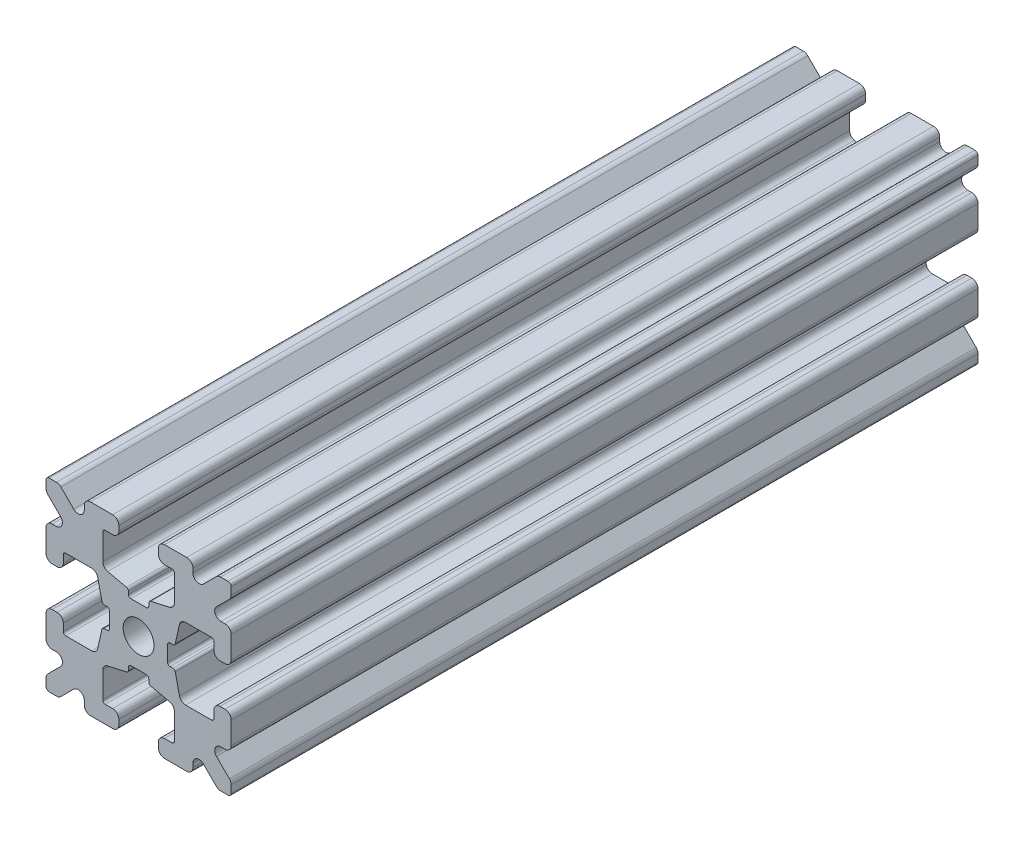
from build123d import *

# Parameters (mm, degrees)
SKETCH1_W           = 15
SKETCH1_H           = 15
SKETCH1_R           = 1.25
BOSS_EXTRUDE1_DEPTH = 30.25
FILLET1_R           = 0.25
CUT_EXTRUDE1_DEPTH  = 62.422715668
CUT_EXTRUDE3_DEPTH  = 62.422715668
FILLET3_R           = 0.5
FILLET4_R           = 0.5
FILLET5_R           = 3
FILLET6_R           = 0.2
CUT_EXTRUDE4_DEPTH  = 62.422715668
FILLET8_R           = 0.5
SKETCH6_W           = 5.1529354
SKETCH6_H           = 1.651
SKETCH6_W_2         = 1.651
SKETCH6_H_2         = 5.1529354
CUT_EXTRUDE5_DEPTH  = 62.422715668
FILLET10_R          = 0.2


with BuildPart() as part:
    # Sketch1 → Boss-Extrude1 (new, symmetric)
    with BuildSketch(Plane.XY):
        Rectangle(SKETCH1_W, SKETCH1_H)
        Circle(SKETCH1_R, mode=Mode.SUBTRACT)
    extrude(amount=BOSS_EXTRUDE1_DEPTH, both=True)

    # Fillet1
    fillet1_edges = [part.edges().sort_by_distance(p)[0] for p in [
        (7.5, -7.5, 0),
        (-7.5, -7.5, 0),
        (7.5, 7.5, 0),
        (-7.5, 7.5, 0),
    ]]
    fillet(fillet1_edges, radius=FILLET1_R)

    # Sketch2 → Cut-Extrude1 (cut, through all)
    with BuildSketch(Plane.XY.offset(30.25)):
        Polygon((-7.5, 1.6), (-6.1, 1.6), (-6.1, 2.9), (-3.4, 2.9), (-3.4, -2.9), (-6.1, -2.9), (-6.1, -1.6), (-7.5, -1.6), align=None)
        Polygon((2.9, 6.1), (1.6, 6.1), (1.6, 7.5), (-1.6, 7.5), (-1.6, 6.1), (-2.9, 6.1), (-2.9, 3.4), (2.9, 3.4), align=None)
        Polygon((-1.6, -7.5), (-1.6, -6.1), (-2.9, -6.1), (-2.9, -3.4), (2.9, -3.4), (2.9, -6.1), (1.6, -6.1), (1.6, -7.5), align=None)
        Polygon((6.1, -2.9), (6.1, -1.6), (7.5, -1.6), (7.5, 1.6), (6.1, 1.6), (6.1, 2.9), (3.4, 2.9), (3.4, -2.9), align=None)
    extrude(amount=-CUT_EXTRUDE1_DEPTH, mode=Mode.SUBTRACT)

    # Sketch4 → Cut-Extrude3 (cut, through all)
    with BuildSketch(Plane.XY.offset(30.25)):
        Polygon((-3.4, 2.9), (-2.75, 0), (-3.4, -2.9), align=None)
        Polygon((-2.9, 3.4), (0, 2.75), (2.9, 3.4), align=None)
        Polygon((3.4, 2.9), (2.75, 0), (3.4, -2.9), align=None)
        Polygon((-2.9, -3.4), (0, -2.75), (2.9, -3.4), align=None)
    extrude(amount=-CUT_EXTRUDE3_DEPTH, mode=Mode.SUBTRACT)

    # Fillet3
    fillet3_edges = [part.edges().sort_by_distance(p)[0] for p in [
        (-6.1, -1.6, 0),
        (-7.5, -1.6, 0),
        (-6.1, 1.6, 0),
        (-7.5, 1.6, 0),
        (-1.6, -7.5, 0),
        (-1.6, -6.1, 0),
        (1.6, -7.5, 0),
        (1.6, -6.1, 0),
        (6.1, -1.6, 0),
        (7.5, -1.6, 0),
        (7.5, 1.6, 0),
        (6.1, 1.6, 0),
        (1.6, 7.5, 0),
        (1.6, 6.1, 0),
        (-1.6, 7.5, 0),
        (-1.6, 6.1, 0),
    ]]
    fillet(fillet3_edges, radius=FILLET3_R)

    # Fillet4
    fillet4_edges = [part.edges().sort_by_distance(p)[0] for p in [
        (-3.4, 2.9, 0),
        (-3.4, -2.9, 0),
        (2.9, -3.4, 0),
        (-2.9, -3.4, 0),
        (3.4, -2.9, 0),
        (3.4, 2.9, 0),
        (-2.9, 3.4, 0),
        (2.9, 3.4, 0),
    ]]
    fillet(fillet4_edges, radius=FILLET4_R)

    # Fillet5
    fillet5_edges = [part.edges().sort_by_distance(p)[0] for p in [
        (0, -2.75, 0),
        (2.75, 0, 0),
        (-2.75, 0, 0),
        (0, 2.75, 0),
    ]]
    fillet(fillet5_edges, radius=FILLET5_R)

    # Fillet6
    fillet6_edges = [part.edges().sort_by_distance(p)[0] for p in [
        (-2.9, -6.1, 0),
        (2.9, -6.1, 0),
        (6.1, -2.9, 0),
        (6.1, 2.9, 0),
        (2.9, 6.1, 0),
        (-2.9, 6.1, 0),
        (-6.1, -2.9, 0),
        (-6.1, 2.9, 0),
    ]]
    fillet(fillet6_edges, radius=FILLET6_R)

    # Sketch5 → Cut-Extrude4 (cut, through all)
    with BuildSketch(Plane.XY.offset(30.25)):
        Polygon((-7.5, 6.439339828), (-5.460660172, 4.4), (-7.5, 4.4), align=None)
        Polygon((-6.439339828, 7.5), (-4.4, 5.460660172), (-4.4, 7.5), align=None)
        Polygon((4.4, 7.5), (6.439339828, 7.5), (4.4, 5.460660172), align=None)
        Polygon((7.5, 6.439339828), (7.5, 4.4), (5.460660172, 4.4), align=None)
        Polygon((7.5, -6.439339828), (5.460660172, -4.4), (7.5, -4.4), align=None)
        Polygon((6.439339828, -7.5), (4.4, -5.460660172), (4.4, -7.5), align=None)
        Polygon((-4.4, -7.5), (-6.439339828, -7.5), (-4.4, -5.460660172), align=None)
        Polygon((-7.5, -6.439339828), (-7.5, -4.4), (-5.460660172, -4.4), align=None)
    extrude(amount=-CUT_EXTRUDE4_DEPTH, mode=Mode.SUBTRACT)

    # Fillet8
    fillet8_edges = [part.edges().sort_by_distance(p)[0] for p in [
        (-5.460660172, 4.4, 0),
        (-7.5, 4.4, 0),
        (-5.460660172, -4.4, 0),
        (-7.5, -4.4, 0),
        (-4.4, -7.5, 0),
        (-4.4, -5.460660172, 0),
        (4.4, -7.5, 0),
        (4.4, -5.460660172, 0),
        (5.460660172, -4.4, 0),
        (7.5, -4.4, 0),
        (7.5, 4.4, 0),
        (5.460660172, 4.4, 0),
        (4.4, 5.460660172, 0),
        (4.4, 7.5, 0),
        (-4.4, 5.460660172, 0),
        (-4.4, 7.5, 0),
        (-6.439339828, 7.5, 0),
        (-7.5, 6.439339828, 0),
        (6.439339828, 7.5, 0),
        (7.5, 6.439339828, 0),
        (6.439339828, -7.5, 0),
        (7.5, -6.439339828, 0),
        (-6.439339828, -7.5, 0),
        (-7.5, -6.439339828, 0),
    ]]
    fillet(fillet8_edges, radius=FILLET8_R)

    # Sketch6 → Cut-Extrude5 (cut, through all)
    with BuildSketch(Plane.XY.offset(30.25)):
        with Locations((4.9235323, 0)):
            Rectangle(SKETCH6_W, SKETCH6_H)
        with Locations((0, -4.9235323)):
            Rectangle(SKETCH6_W_2, SKETCH6_H_2)
        with Locations((-4.9235323, 0)):
            Rectangle(SKETCH6_W, SKETCH6_H)
        with Locations((0, 4.9235323)):
            Rectangle(SKETCH6_W_2, SKETCH6_H_2)
    extrude(amount=-CUT_EXTRUDE5_DEPTH, mode=Mode.SUBTRACT)

    # Fillet10
    fillet10_edges = [part.edges().sort_by_distance(p)[0] for p in [
        (-2.935025862, 0.8255, 0),
        (-2.935025862, -0.8255, 0),
        (2.935025862, -0.8255, 0),
        (2.935025862, 0.8255, 0),
        (0.8255, 2.935025862, 0),
        (-0.8255, 2.935025862, 0),
        (-2.3470646, 0.8255, 0),
        (-2.3470646, -0.8255, 0),
        (0.8255, 2.3470646, 0),
        (-0.8255, 2.3470646, 0),
        (2.3470646, 0.8255, 0),
        (2.3470646, -0.8255, 0),
        (0.8255, -2.935025862, 0),
        (0.8255, -2.3470646, 0),
        (-0.8255, -2.3470646, 0),
        (-0.8255, -2.935025862, 0),
    ]]
    fillet(fillet10_edges, radius=FILLET10_R)


solid = part.part
